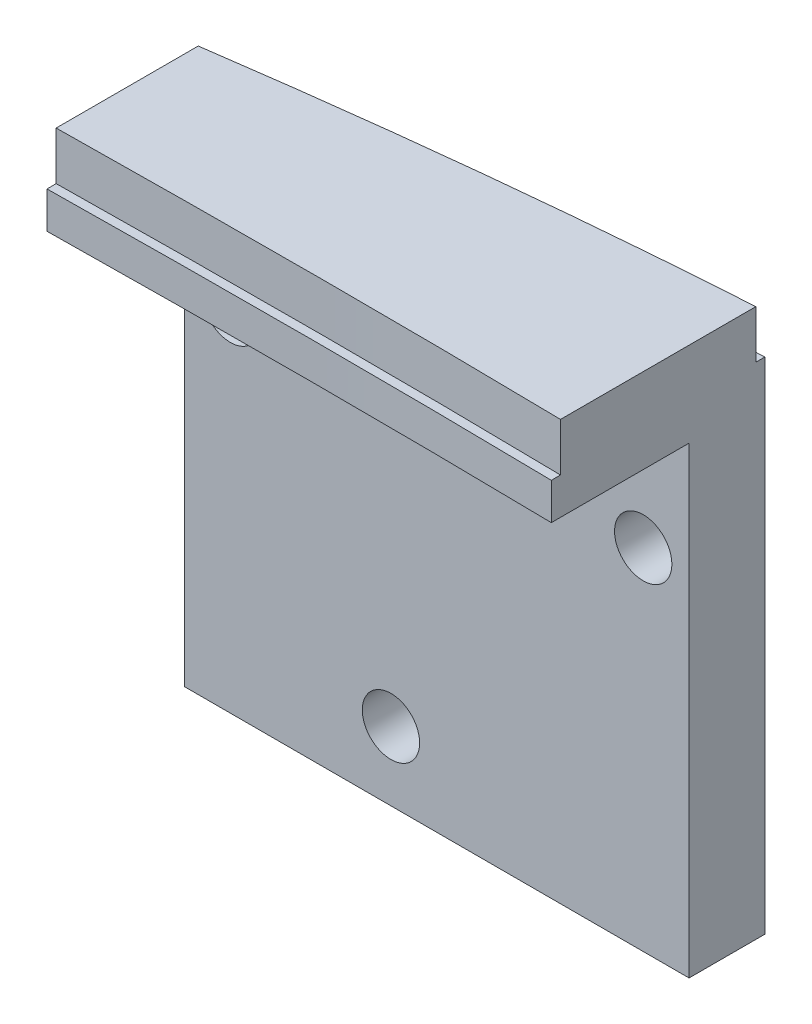
from build123d import *

# Parameters (mm, degrees)
BOSS_EXTRUDE2_DEPTH = 47.8
CUT_EXTRUDE1_DEPTH  = 4.2
CUT_EXTRUDE2_START  = -7.4
CUT_EXTRUDE2_DEPTH  = 51.536189994
SKETCH3_R           = 2.5
CUT_EXTRUDE3_DEPTH  = 58.376025302


with BuildPart() as part:
    # Sketch1 → Boss-Extrude2 (new body)
    with BuildSketch(Plane(origin=(0, 0, 0), x_dir=(1, 0, 0), z_dir=(0, 1, 0))):
        with BuildLine():
            add(Edge.make_bspline(
                [(-29.373831617, 9.831440884), (-23.702910793, 10.644953131), (-13.407338059, 11.985082278), (1.281123888, 13.49777136), (10.220462704, 14.180602356), (14.626168383, 14.454760768)],
                knots=[0.119742515, 0.119742515, 0.119742515, 0.119742515, 0.136319699, 0.149951669, 0.163562333, 0.163562333, 0.163562333, 0.163562333], degree=3))
            Line((-29.373831617, 9.831440884), (-29.373831617, -4.168559116))
            add(Edge.make_bspline(
                [(14.626168383, -4.182978694), (12.933162782, -4.151781773), (2.223142231, -3.981238854), (-12.472719778, -3.968638532), (-25.439097931, -4.112708664), (-29.373831617, -4.168559116)],
                knots=[0.744962106, 0.744962106, 0.744962106, 0.744962106, 0.752707968, 0.793923307, 0.811910449, 0.811910449, 0.811910449, 0.811910449], degree=3))
            Line((14.626168383, -4.182978694), (14.626168383, 14.454760768))
        make_face()
    extrude(amount=-BOSS_EXTRUDE2_DEPTH)

    # Sketch1<3> → Cut-Extrude1 (cut)
    with BuildSketch(Plane(origin=(0, 0, 0), x_dir=(1, 0, 0), z_dir=(0, 1, 0))):
        with BuildLine():
            add(Edge.make_bspline(
                [(-29.373831617, 9.831440884), (-23.702910793, 10.644953131), (-13.407338059, 11.985082278), (1.281123888, 13.49777136), (10.220462704, 14.180602356), (14.626168383, 14.454760768)],
                knots=[0.119742515, 0.119742515, 0.119742515, 0.119742515, 0.136319699, 0.149951669, 0.163562333, 0.163562333, 0.163562333, 0.163562333], degree=3))
            Line((-29.373831617, 9.831440884), (-29.373831617, 9.023325197))
            add(Edge.make_bspline(
                [(-29.373831617, 9.023325197), (-23.907676285, 9.80852946), (-11.876723061, 11.382311402), (2.777730924, 12.83368182), (11.866327435, 13.481222305), (14.626168383, 13.653256663)],
                knots=[0.119631072, 0.119631072, 0.119631072, 0.119631072, 0.13562759, 0.154970796, 0.163510366, 0.163510366, 0.163510366, 0.163510366], degree=3))
            Line((14.626168383, 13.653256663), (14.626168383, 14.454760768))
        make_face()
        with BuildLine():
            add(Edge.make_bspline(
                [(14.626168383, -3.382985836), (11.073485586, -3.317625516), (1.076994098, -3.185956595), (-13.61308178, -3.184990814), (-24.717461987, -3.302723406), (-29.373831617, -3.368729311)],
                knots=[0.744984429, 0.744984429, 0.744984429, 0.744984429, 0.761227479, 0.790619235, 0.811896601, 0.811896601, 0.811896601, 0.811896601], degree=3))
            Line((-29.373831617, -3.368729311), (-29.373831617, -4.168559116))
            add(Edge.make_bspline(
                [(14.626168383, -4.182978694), (12.933162782, -4.151781773), (2.223142231, -3.981238854), (-12.472719778, -3.968638532), (-25.439097931, -4.112708664), (-29.373831617, -4.168559116)],
                knots=[0.744962106, 0.744962106, 0.744962106, 0.744962106, 0.752707968, 0.793923307, 0.811910449, 0.811910449, 0.811910449, 0.811910449], degree=3))
            Line((14.626168383, -4.182978694), (14.626168383, -3.382985836))
        make_face()
    extrude(amount=-CUT_EXTRUDE1_DEPTH, mode=Mode.SUBTRACT)

    # Sketch2 → Cut-Extrude2 (cut, through all)
    with BuildSketch(Plane(origin=(0, 0, 0), x_dir=(1, 0, 0), z_dir=(0, 1, 0)).offset(CUT_EXTRUDE2_START)):
        with BuildLine():
            Line((14.626168383, 7.831440884), (-29.373831617, 7.831440884))
            Line((-29.373831617, 7.831440884), (-29.373831617, -4.168559116))
            add(Edge.make_bspline(
                [(14.626168383, -4.182978694), (12.933162782, -4.151781773), (2.223142231, -3.981238854), (-12.472719778, -3.968638532), (-25.439097931, -4.112708664), (-29.373831617, -4.168559116)],
                knots=[0.744962106, 0.744962106, 0.744962106, 0.744962106, 0.752707968, 0.793923307, 0.811910449, 0.811910449, 0.811910449, 0.811910449], degree=3))
            Line((14.626168383, -4.182978694), (14.626168383, 7.831440884))
        make_face()
    extrude(amount=-CUT_EXTRUDE2_DEPTH, mode=Mode.SUBTRACT)

    # Sketch3 → Cut-Extrude3 (cut, through all)
    with BuildSketch(Plane.XY.offset(-7.831440884)):
        with Locations((-11.373831617, -41.8)):
            Circle(SKETCH3_R)
        with Locations((-25.373831617, -17.3)):
            Circle(SKETCH3_R)
        with Locations((10.626168383, -17.3)):
            Circle(SKETCH3_R)
    extrude(amount=-CUT_EXTRUDE3_DEPTH, mode=Mode.SUBTRACT)


solid = part.part
